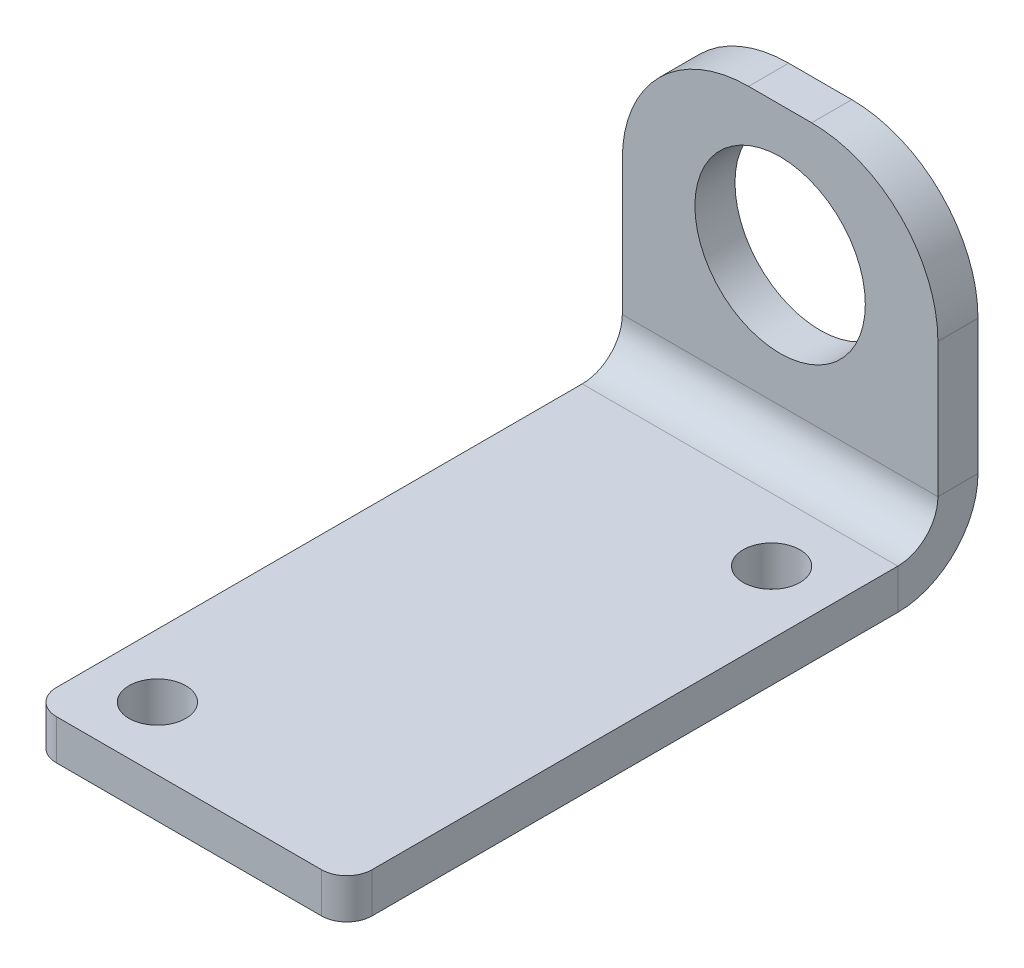
from build123d import *

# Parameters (mm, degrees)
SKETCH1_W                    = 25
SKETCH1_H                    = 50
BASE_FLANGE1_DEPTH           = 3.175
EDGE_FLANGE1_STRIP_W         = 19.05
EDGE_FLANGE1_STRIP_H         = 3.175
EDGE_FLANGE1_STRIP_CUT_DEPTH = 25
EDGE_FLANGE1_DEPTH           = 25
M12_CLEARANCE_HOLE1_D        = 13.5
M4_CLEARANCE_HOLE1_D         = 4.5
FILLET1_R                    = 10
FILLET2_R                    = 2


# Sheet-metal steps are written as plain solids
with BuildPart() as part:
    # Sketch1 → Base-Flange1 (new body)
    with BuildSketch(Plane(origin=(0, 0, 0), x_dir=(1, 0, 0), z_dir=(0, 1, 0))):
        with Locations((0, 25)):
            Rectangle(SKETCH1_W, SKETCH1_H)
    extrude(amount=-BASE_FLANGE1_DEPTH)

    # Edge-Flange1 strip (across the edge) → Edge-Flange1 strip cut (cut)
    with BuildSketch(Plane(origin=(12.5, 0, -50), x_dir=(0, 0, 1), z_dir=(-1, 0, 0))):
        with Locations((-3.175, -1.5875)):
            Rectangle(EDGE_FLANGE1_STRIP_W, EDGE_FLANGE1_STRIP_H)
    extrude(amount=EDGE_FLANGE1_STRIP_CUT_DEPTH, mode=Mode.SUBTRACT)

    # Edge-Flange1 section (across the edge) → Edge-Flange1 (add)
    with BuildSketch(Plane(origin=(12.5, 0, -50), x_dir=(0, 0, 1), z_dir=(-1, 0, 0))):
        with BuildLine():
            Line((0, 3.175), (0, 23.825))
            Line((0, 23.825), (3.175, 23.825))
            Line((3.175, 23.825), (3.175, 3.175))
            ThreePointArc((3.175, 3.175), (4.10493597, 0.92993597), (6.35, 0))
            Line((6.35, 0), (6.35, -3.175))
            ThreePointArc((6.35, -3.175), (1.859871939, -1.315128061), (0, 3.175))
        make_face()
    extrude(amount=EDGE_FLANGE1_DEPTH)

    # M12 Clearance Hole1 (through all)
    with Locations(Plane(origin=(0, 0, -50), x_dir=(-1, 0, 0), z_dir=(0, 0, -1))):
        with Locations((0, 13.5)):
            Hole(M12_CLEARANCE_HOLE1_D / 2)

    # M4 Clearance Hole1 (through all)
    with Locations(Plane(origin=(0, 0, 0), x_dir=(1, 0, 0), z_dir=(0, 1, 0))):
        with Locations((-7.5, 5), (7.5, 38.65)):
            Hole(M4_CLEARANCE_HOLE1_D / 2)

    # Fillet1
    fillet1_edges = [part.edges().sort_by_distance(p)[0] for p in [
        (12.5, 23.825, -48.4125),
        (-12.5, 23.825, -48.4125),
    ]]
    fillet(fillet1_edges, radius=FILLET1_R)

    # Fillet2
    fillet2_edges = [part.edges().sort_by_distance(p)[0] for p in [
        (12.5, -1.5875, 0),
        (-12.5, -1.5875, 0),
    ]]
    fillet(fillet2_edges, radius=FILLET2_R)


solid = part.part
